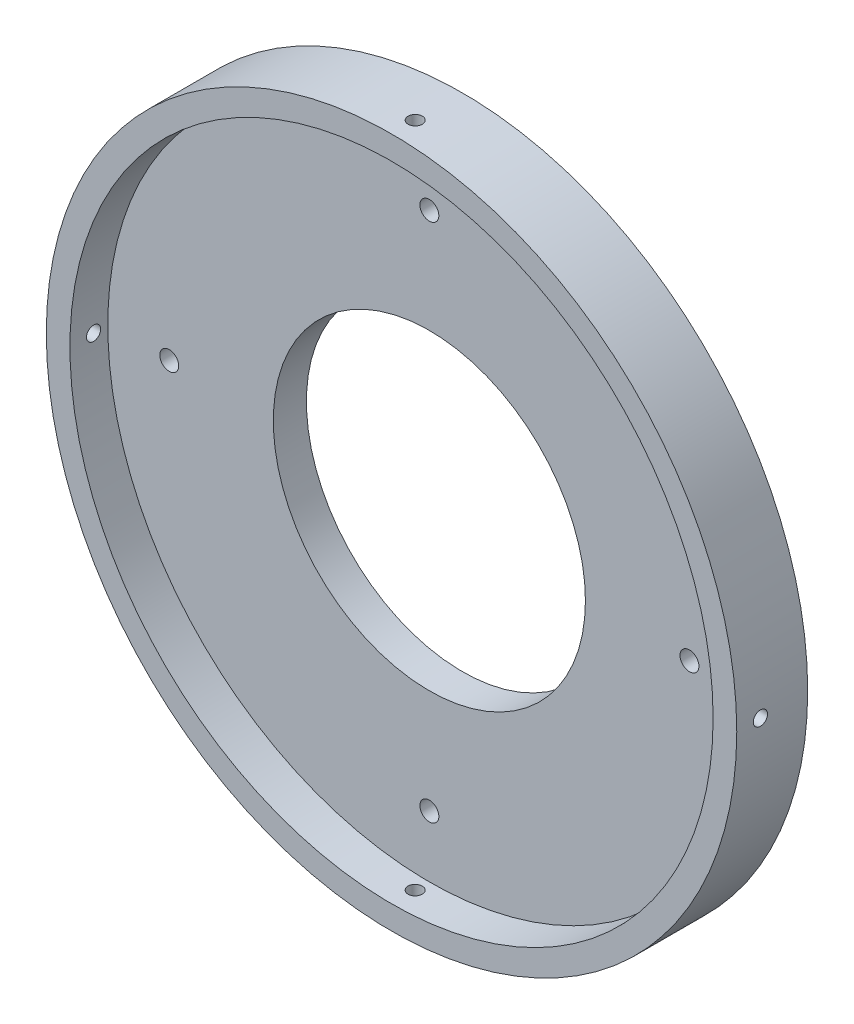
from build123d import *

# Parameters (mm, degrees)
SKETCH1_R               = 73
SKETCH1_R_2             = 33
BOSS_EXTRUDE1_DEPTH     = 7
SKETCH2_R               = 73
SKETCH2_R_2             = 68
BOSS_EXTRUDE2_DEPTH     = 8
CUT_EXTRUDE1_REACH      = 106.322
CUT_EXTRUDE1_END_RADIUS = 73
SKETCH3_R               = 1.5
CIRPATTERN1_COUNT       = 4
F_4_0MM_DOWEL_HOLE1_D   = 4
CUT_EXTRUDE2_DEPTH      = 3.2


with BuildPart() as part:
    # Sketch1 → Boss-Extrude1 (new body)
    with BuildSketch(Plane.XY):
        Circle(SKETCH1_R)
        Circle(SKETCH1_R_2, mode=Mode.SUBTRACT)
    extrude(amount=BOSS_EXTRUDE1_DEPTH)

    # Sketch2 → Boss-Extrude2 (add)
    with BuildSketch(Plane.XY.offset(7)):
        Circle(SKETCH2_R)
        Circle(SKETCH2_R_2, mode=Mode.SUBTRACT)
    extrude(amount=BOSS_EXTRUDE2_DEPTH)

    # Cut-Extrude1: up to this cylinder (the profile starts inside it)
    cut_extrude1_end = Plane(origin=(0, 0, 10), z_dir=(0, 0, -1)) * Cylinder(CUT_EXTRUDE1_END_RADIUS, 359.644, mode=Mode.PRIVATE)
    # Sketch3 → Cut-Extrude1 (cut, up to the surface)
    with BuildSketch(Plane(origin=(0, 0, 0), x_dir=(1, 0, 0), z_dir=(0, 1, 0)), mode=Mode.PRIVATE) as cut_extrude1_sk1:
        with Locations((0, -10)):
            Circle(SKETCH3_R)
    cut_extrude1_tool1 = extrude(cut_extrude1_sk1.sketch, amount=-CUT_EXTRUDE1_REACH, mode=Mode.PRIVATE) & cut_extrude1_end
    cut_extrude1 = cut_extrude1_tool1.solids().sort_by_distance((0, 0, 10))[0]
    add(cut_extrude1, mode=Mode.SUBTRACT)

    # CirPattern1: Cut-Extrude1 ×4 about axis
    cirpattern1_axis = Axis((0, 0, 7), (0, 0, -1))
    for i in range(1, CIRPATTERN1_COUNT):
        add(cut_extrude1.rotate(cirpattern1_axis, i * 360 / CIRPATTERN1_COUNT), mode=Mode.SUBTRACT)

    # Ø4.0mm Dowel Hole1 (through all)
    with Locations(Plane(origin=(0, 0, 0), x_dir=(-1, 0, 0), z_dir=(0, 0, -1))):
        with Locations((0, 55), (55, 0), (0, -55), (-55, 0)):
            Hole(F_4_0MM_DOWEL_HOLE1_D / 2)

    # Sketch13 → Cut-Extrude2 (cut)
    with BuildSketch(Plane(origin=(0, 0, 0), x_dir=(-1, 0, 0), z_dir=(0, 0, -1))):
        Polygon((4.041451884, 55), (2.020725942, 58.5), (-2.020725942, 58.5), (-4.041451884, 55), (-2.020725942, 51.5), (2.020725942, 51.5), align=None)
        Polygon((55, -4.041451884), (58.5, -2.020725942), (58.5, 2.020725942), (55, 4.041451884), (51.5, 2.020725942), (51.5, -2.020725942), align=None)
        Polygon((-4.041451884, -55), (-2.020725942, -58.5), (2.020725942, -58.5), (4.041451884, -55), (2.020725942, -51.5), (-2.020725942, -51.5), align=None)
        Polygon((-55, 4.041451884), (-58.5, 2.020725942), (-58.5, -2.020725942), (-55, -4.041451884), (-51.5, -2.020725942), (-51.5, 2.020725942), align=None)
    extrude(amount=-CUT_EXTRUDE2_DEPTH, mode=Mode.SUBTRACT)


solid = part.part
